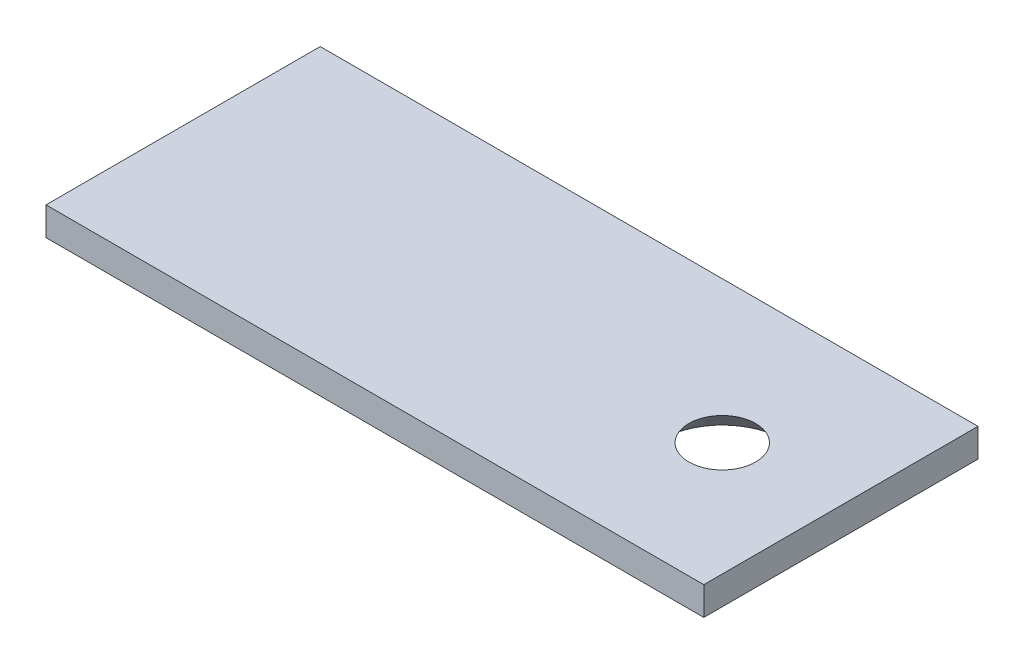
from build123d import *

# Parameters (mm, degrees)
SKETCH_1_W             = 19.3
SKETCH_1_H             = 2
SM_BASE_FLANGE_1_DEPTH = 46.3
SKETCH_7_R             = 2.3
CUT_EXTRUDE_2_DEPTH    = 51.201394403
CHAMFER_2_SIZE         = 2.05


# Sheet-metal steps are written as plain solids
with BuildPart() as part:
    # Sketch 1 → Базовая кромка1 (new body)
    with BuildSketch(Plane(origin=(0, 0, 0), x_dir=(0, 0, -1), z_dir=(1, 0, 0))):
        with Locations((9.65, 1)):
            Rectangle(SKETCH_1_W, SKETCH_1_H)
    extrude(amount=-SM_BASE_FLANGE_1_DEPTH)

    # Эскиз7 → Вырез-Вытянуть2 (cut, through all)
    with BuildSketch(Plane(origin=(0, 2, 0), x_dir=(1, 0, 0), z_dir=(0, 1, 0))):
        with Locations(Location((-8, 9.3, 0), (0, 0, 270))):
            Circle(SKETCH_7_R)
    extrude(amount=-CUT_EXTRUDE_2_DEPTH, mode=Mode.SUBTRACT)

    # Фаска2
    # the kernel refuses this chamfer: 2.05 mm, written as the material it takes off along each edge
    with BuildSketch(Plane(origin=(-8, 0, -9.3), x_dir=(0, 0, 1), z_dir=(-1, 0, 0))) as chamfer_2_piece_1:
        Polygon((2.3 + CHAMFER_2_SIZE, 0), (2.3, CHAMFER_2_SIZE), (2.3, 0), align=None)
    revolve(axis=Axis((-8, 0, -9.3), (0, 1, 0)), mode=Mode.SUBTRACT)


solid = part.part
